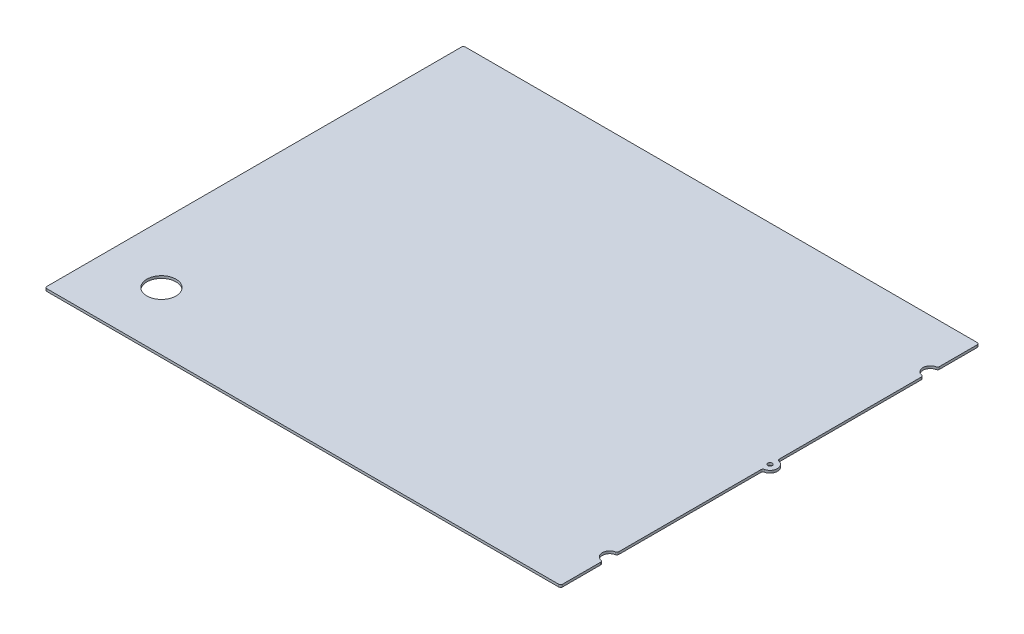
from build123d import *

# Parameters (mm, degrees)
BOSS_EXTRUDE1_DEPTH        = 3.175
F_1_0_228_DIAMETER_HOLE2_D = 5.7912
FILLET2_R                  = 2.54
SKETCH12_R                 = 19.05
CUT_EXTRUDE3_DEPTH         = 3.175


with BuildPart() as part:
    # Sketch1 → Boss-Extrude1 (new body)
    with BuildSketch(Plane(origin=(0, 0, 0), x_dir=(1, 0, 0), z_dir=(0, 1, 0))):
        with BuildLine():
            Line((337.058, 219.456), (337.058, 273.558))
            Line((337.058, 273.558), (-337.058, 273.558))
            Line((-337.058, 273.558), (-337.058, -273.558))
            Line((-337.058, -273.558), (337.058, -273.558))
            Line((337.058, -273.558), (337.058, -218.948))
            ThreePointArc((337.058, -218.948), (327.406, -209.296), (337.058, -199.644))
            Line((337.058, -199.644), (337.058, -9.398))
            ThreePointArc((337.058, -9.398), (346.71, 0.254), (337.058, 9.906))
            Line((337.058, 9.906), (337.058, 200.152))
            ThreePointArc((337.058, 200.152), (327.406, 209.804), (337.058, 219.456))
        make_face()
    extrude(amount=BOSS_EXTRUDE1_DEPTH)

    # #1 (0.228) Diameter Hole2 (through all)
    with Locations(Plane(origin=(0, 3.175, 0), x_dir=(1, 0, 0), z_dir=(0, 1, 0))):
        with Locations((337.058, 0.254)):
            Hole(F_1_0_228_DIAMETER_HOLE2_D / 2)

    # Fillet2
    fillet2_edges = [part.edges().sort_by_distance(p)[0] for p in [
        (-337.058, 1.5875, -273.558),
        (-337.058, 1.5875, 273.558),
        (337.058, 1.5875, 273.558),
        (337.058, 1.5875, 218.948),
        (337.058, 1.5875, 199.644),
        (337.058, 1.5875, 9.398),
        (337.058, 1.5875, -9.906),
        (337.058, 1.5875, -200.152),
        (337.058, 1.5875, -219.456),
        (337.058, 1.5875, -273.558),
    ]]
    fillet(fillet2_edges, radius=FILLET2_R)

    # Sketch12 → Cut-Extrude3 (cut)
    with BuildSketch(Plane(origin=(0, 3.175, 0), x_dir=(1, 0, 0), z_dir=(0, 1, 0))):
        with Locations((-260.858, -197.358)):
            Circle(SKETCH12_R)
    extrude(amount=-CUT_EXTRUDE3_DEPTH, mode=Mode.SUBTRACT)


solid = part.part
